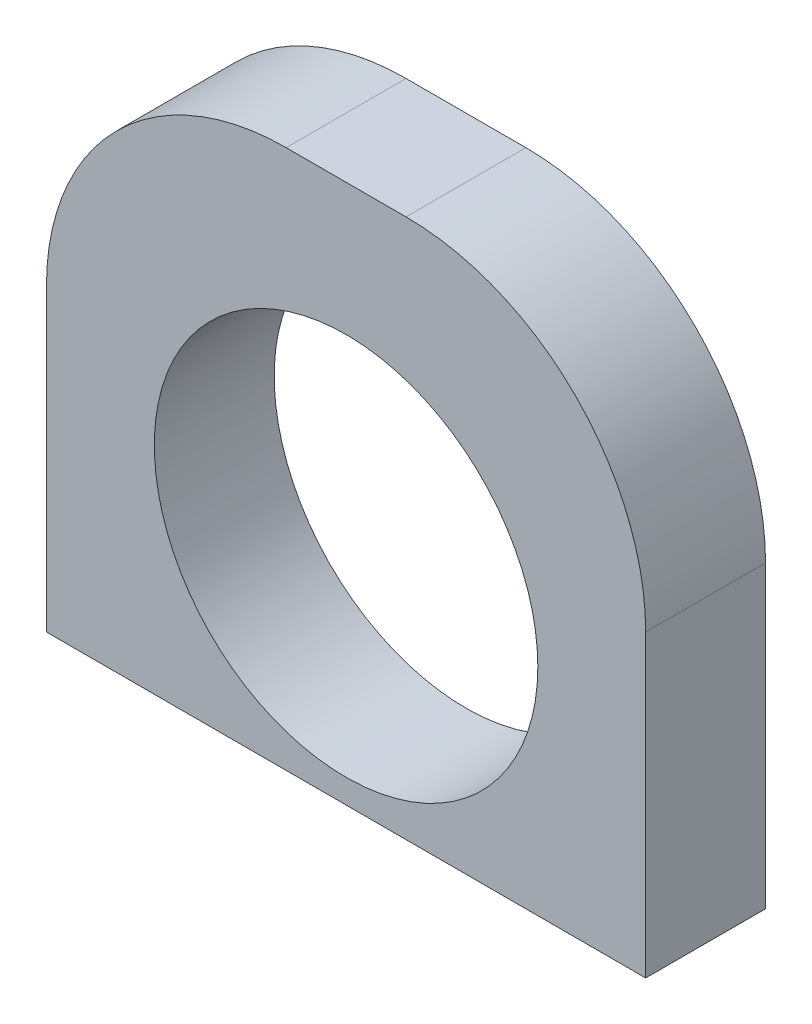
from build123d import *

# Parameters (mm, degrees)
SKETCH1_R           = 10.16
BOSS_EXTRUDE3_DEPTH = 6.35


with BuildPart() as part:
    # Sketch1 → Boss-Extrude3 (new body)
    with BuildSketch(Plane.XY):
        with BuildLine():
            Line((-15.875, -14.2875), (15.875, -14.2875))
            Line((15.875, -14.2875), (15.875, 1.5875))
            ThreePointArc((15.875, 1.5875), (12.155256121, 10.567756121), (3.175, 14.2875))
            Line((3.175, 14.2875), (-3.175, 14.2875))
            ThreePointArc((-3.175, 14.2875), (-12.155256121, 10.567756121), (-15.875, 1.5875))
            Line((-15.875, 1.5875), (-15.875, -14.2875))
        make_face()
        with Locations((0, -2.8575)):
            Circle(SKETCH1_R, mode=Mode.SUBTRACT)
    extrude(amount=BOSS_EXTRUDE3_DEPTH)


solid = part.part
